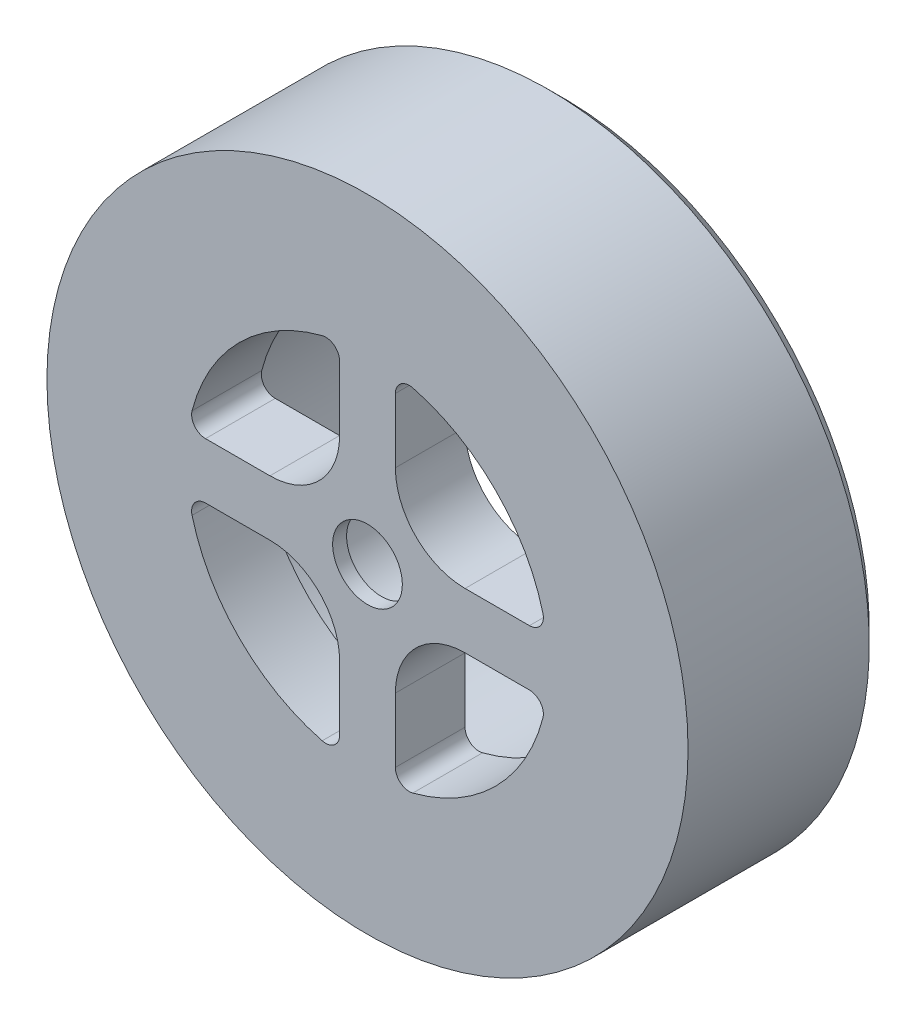
from build123d import *

# Parameters (mm, degrees)
ESBO_O1_R                = 23
ESBO_O1_R_2              = 13.905
RESSALTO_EXTRUS_O1_DEPTH = 11
ESBO_O2_R                = 23
RESSALTO_EXTRUS_O2_DEPTH = 5
ESBO_O3_R                = 2.5
CORTE_EXTRUS_O1_DEPTH    = 18
ESBO_O4_R                = 4.5
CORTE_EXTRUS_O2_DEPTH    = 4
CORTE_EXTRUS_O3_DEPTH    = 15
ESBO_O6_R                = 24.343049023
CORTE_EXTRUS_O4_DEPTH    = 2
CHANFRO1_SIZE            = 1


with BuildPart() as part:
    # Esboço1 → Ressalto-extrusão1 (new body)
    with BuildSketch(Plane.XY):
        Circle(ESBO_O1_R)
        Circle(ESBO_O1_R_2, mode=Mode.SUBTRACT)
    extrude(amount=RESSALTO_EXTRUS_O1_DEPTH)

    # Esboço2 → Ressalto-extrusão2 (add)
    with BuildSketch(Plane.XY.offset(11)):
        Circle(ESBO_O2_R)
    extrude(amount=RESSALTO_EXTRUS_O2_DEPTH)

    # Esboço3 → Corte-extrusão1 (cut)
    with BuildSketch(Plane.XY.offset(16)):
        Circle(ESBO_O3_R)
    extrude(amount=-CORTE_EXTRUS_O1_DEPTH, mode=Mode.SUBTRACT)

    # Esboço4 → Corte-extrusão2 (cut)
    with BuildSketch(Plane(origin=(0, 0, 11), x_dir=(-1, 0, 0), z_dir=(0, 0, -1))):
        Circle(ESBO_O4_R)
    extrude(amount=-CORTE_EXTRUS_O2_DEPTH, mode=Mode.SUBTRACT)

    # Esboço5 → Corte-extrusão3 (cut)
    with BuildSketch(Plane.XY.offset(16)):
        with BuildLine():
            Line((-2, 11.618950039), (-2, 7))
            ThreePointArc((-2, 7), (-3.464466094, 3.464466094), (-7, 2))
            Line((-7, 2), (-11.618950039, 2))
            ThreePointArc((-11.618950039, 2), (-12.409519454, 2.387627564), (-12.587195875, 3.25))
            ThreePointArc((-12.587195875, 3.25), (-9.192388155, 9.192388155), (-3.25, 12.587195875))
            ThreePointArc((-3.25, 12.587195875), (-2.387627564, 12.409519454), (-2, 11.618950039))
        make_face()
        with BuildLine():
            Line((2, 11.618950039), (2, 7))
            ThreePointArc((2, 7), (3.464466094, 3.464466094), (7, 2))
            Line((7, 2), (11.618950039, 2))
            ThreePointArc((11.618950039, 2), (12.409519454, 2.387627564), (12.587195875, 3.25))
            ThreePointArc((12.587195875, 3.25), (9.192388155, 9.192388155), (3.25, 12.587195875))
            ThreePointArc((3.25, 12.587195875), (2.387627564, 12.409519454), (2, 11.618950039))
        make_face()
        with BuildLine():
            Line((2, -7), (2, -11.618950039))
            ThreePointArc((2, -11.618950039), (2.387627564, -12.409519454), (3.25, -12.587195875))
            ThreePointArc((3.25, -12.587195875), (9.192388155, -9.192388155), (12.587195875, -3.25))
            ThreePointArc((12.587195875, -3.25), (12.409519454, -2.387627564), (11.618950039, -2))
            Line((11.618950039, -2), (7, -2))
            ThreePointArc((7, -2), (3.464466094, -3.464466094), (2, -7))
        make_face()
        with BuildLine():
            Line((-2, -7), (-2, -11.618950039))
            ThreePointArc((-2, -11.618950039), (-2.387627564, -12.409519454), (-3.25, -12.587195875))
            ThreePointArc((-3.25, -12.587195875), (-9.192388155, -9.192388155), (-12.587195875, -3.25))
            ThreePointArc((-12.587195875, -3.25), (-12.409519454, -2.387627564), (-11.618950039, -2))
            Line((-11.618950039, -2), (-7, -2))
            ThreePointArc((-7, -2), (-3.464466094, -3.464466094), (-2, -7))
        make_face()
    extrude(amount=-CORTE_EXTRUS_O3_DEPTH, mode=Mode.SUBTRACT)

    # Esboço6 → Corte-extrusão4 (cut)
    with BuildSketch(Plane(origin=(0, 0, 0), x_dir=(-1, 0, 0), z_dir=(0, 0, -1))):
        Circle(ESBO_O6_R)
    extrude(amount=-CORTE_EXTRUS_O4_DEPTH, mode=Mode.SUBTRACT)

    # Chanfro1
    chanfro1_edges = [part.edges().sort_by_distance(p)[0] for p in [
        (-23, 0, 2),
    ]]
    chamfer(chanfro1_edges, length=CHANFRO1_SIZE)


solid = part.part
